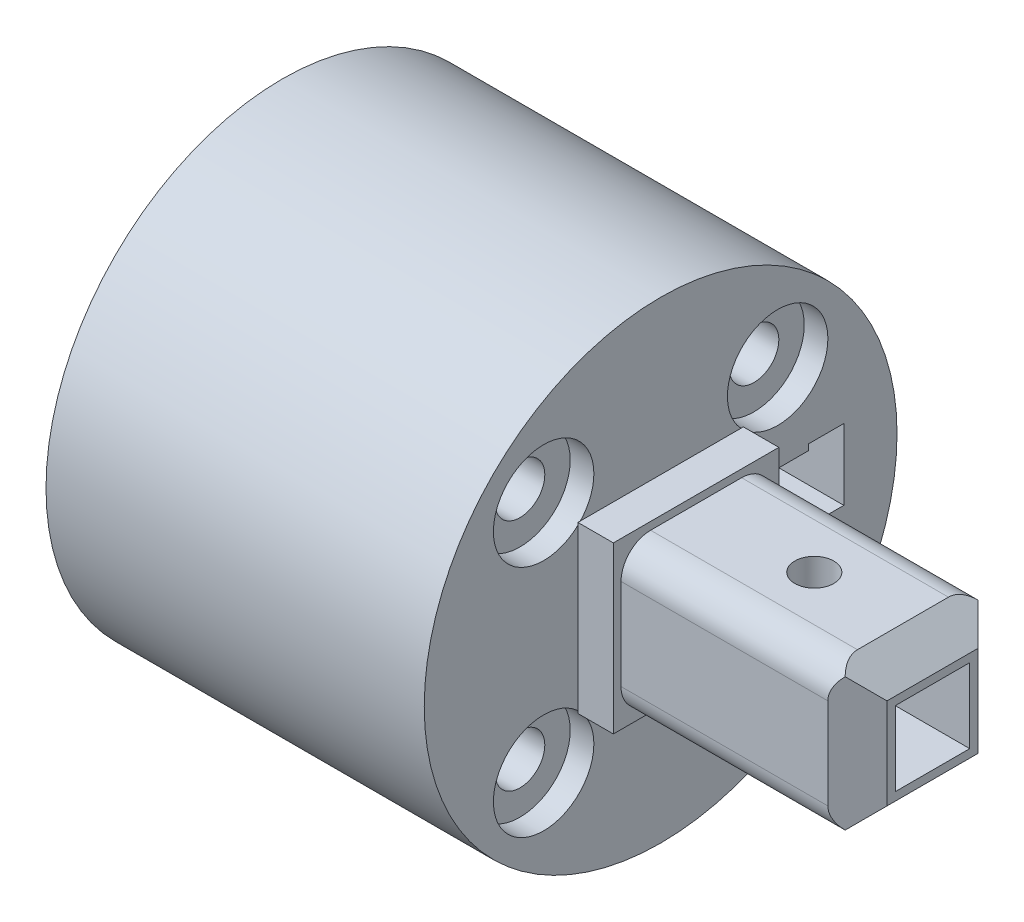
from build123d import *

# Parameters (mm, degrees)
SKETCH_1_R               = 20
EXTRUDE_1_DEPTH          = 5
SKETCH_2_W               = 6.3
SKETCH_2_H               = 6.3
CUT_EXTRUDE_1_DEPTH      = 5
EXTRUDE_START            = 7
SKETCH_4_R               = 20
SKETCH_4_R_2             = 10
EXTRUDE_2_DEPTH          = 7
CUT_EXTRUDE_2_DEPTH      = 20
CUT_EXTRUDE_2_DEPTH_BACK = 20
SKETCH_3_R               = 2.1
SKETCH_5_W               = 3
SKETCH_5_H               = 6
CUT_EXTRUDE_3_DEPTH      = 13
CHAMFER_1_SIZE           = 1
EXTRUDE_START_2          = 20
SKETCH_6_R               = 20
SKETCH_6_R_2             = 18
EXTRUDE_3_DEPTH          = 20
CHAMFER_2_SIZE           = 1
SKETCH_7_R               = 4.25
CUT_EXTRUDE_4_DEPTH      = 2
SKETCH_8_W               = 14
SKETCH_8_H               = 14
EXTRUDE_4_DEPTH          = 3
SKETCH_9_W               = 6.3
SKETCH_9_H               = 6.3
CUT_EXTRUDE_5_DEPTH      = 10
CUT_EXTRUDE_6_DEPTH      = 6
CUT_EXTRUDE_6_DEPTH_BACK = 5
SKETCH_10_W              = 3
SKETCH_10_H              = 5
FILLET_1_R               = 4
FILLET_2_R               = 2
SKETCH_11_W              = 12.7
SKETCH_11_H              = 12.7
SKETCH_11_W_2            = 6.3
SKETCH_11_H_2            = 6.3
EXTRUDE_5_DEPTH          = 20
CHAMFER_3_SIZE           = 2.5
SKETCH_12_R              = 1.65
CUT_EXTRUDE_7_DEPTH      = 20
FILLET_3_R               = 2.5


with BuildPart() as part:
    # 草图1 → 凸台-拉伸1 (new body)
    with BuildSketch(Plane(origin=(0, 0, 0), x_dir=(0, 0, -1), z_dir=(1, 0, 0))):
        Circle(SKETCH_1_R)
    extrude(amount=EXTRUDE_1_DEPTH)

    # 草图2 → 切除-拉伸1 (cut)
    with BuildSketch(Plane(origin=(5, 0, 0), x_dir=(0, 0, -1), z_dir=(1, 0, 0))):
        Rectangle(SKETCH_2_W, SKETCH_2_H)
    extrude(amount=-CUT_EXTRUDE_1_DEPTH, mode=Mode.SUBTRACT)

    # 草图4 → 凸台-拉伸2 (add)
    with BuildSketch(Plane.ZY.offset(EXTRUDE_START)):
        Circle(SKETCH_4_R)
        Circle(SKETCH_4_R_2, mode=Mode.SUBTRACT)
    extrude(amount=-EXTRUDE_2_DEPTH)

    # 草图3 → 切除-拉伸2 (cut, two sides: drawn at the far end of the back side and taken through both)
    with BuildSketch(Plane.ZY.offset(-CUT_EXTRUDE_2_DEPTH_BACK)):
        with Locations(Location((9.899494937, -9.899494937, 0), (0, 0, 180))):
            Circle(SKETCH_3_R)
        with Locations(Location((-9.899494937, -9.899494937, 0), (0, 0, 180))):
            Circle(SKETCH_3_R)
        with Locations(Location((-9.899494937, 9.899494937, 0), (0, 0, 180))):
            Circle(SKETCH_3_R)
        with Locations(Location((9.899494937, 9.899494937, 0), (0, 0, 180))):
            Circle(SKETCH_3_R)
    extrude(amount=CUT_EXTRUDE_2_DEPTH + CUT_EXTRUDE_2_DEPTH_BACK, mode=Mode.SUBTRACT)

    # 草图5 → 切除-拉伸3 (cut)
    with BuildSketch(Plane(origin=(5, 0, 0), x_dir=(0, 0, -1), z_dir=(1, 0, 0))):
        with Locations((14, 0)):
            Rectangle(SKETCH_5_W, SKETCH_5_H)
    extrude(amount=-CUT_EXTRUDE_3_DEPTH, mode=Mode.SUBTRACT)

    # 倒角1
    chamfer_1_edges = [part.edges().sort_by_distance(p)[0] for p in [
        (-7, -3, -14),
        (-7, 0, -15.5),
        (-7, 3, -14),
        (-7, 0, -12.5),
    ]]
    chamfer(chamfer_1_edges, length=CHAMFER_1_SIZE)

    # 草图6 → 凸台-拉伸3 (add)
    with BuildSketch(Plane.ZY.offset(7).offset(EXTRUDE_START_2)):
        Circle(SKETCH_6_R)
        Circle(SKETCH_6_R_2, mode=Mode.SUBTRACT)
    extrude(amount=-EXTRUDE_3_DEPTH)

    # 倒角2
    chamfer_2_edges = [part.edges().sort_by_distance(p)[0] for p in [
        (-27, 0, -18),
    ]]
    chamfer(chamfer_2_edges, length=CHAMFER_2_SIZE)

    # 草图7 → 切除-拉伸4 (cut)
    with BuildSketch(Plane(origin=(5, 0, 0), x_dir=(0, 0, -1), z_dir=(1, 0, 0))):
        with Locations((-9.899494937, 9.899494937)):
            Circle(SKETCH_7_R)
        with Locations((9.899494937, 9.899494937)):
            Circle(SKETCH_7_R)
        with Locations((9.899494937, -9.899494937)):
            Circle(SKETCH_7_R)
        with Locations((-9.899494937, -9.899494937)):
            Circle(SKETCH_7_R)
    extrude(amount=-CUT_EXTRUDE_4_DEPTH, mode=Mode.SUBTRACT)

    # 草图8 → 凸台-拉伸4 (add)
    with BuildSketch(Plane(origin=(5, 0, 0), x_dir=(0, 0, -1), z_dir=(1, 0, 0))):
        Rectangle(SKETCH_8_W, SKETCH_8_H)
    extrude(amount=EXTRUDE_4_DEPTH)

    # 草图9 → 切除-拉伸5 (cut)
    with BuildSketch(Plane.ZY.offset(-5)):
        Rectangle(SKETCH_9_W, SKETCH_9_H)
    extrude(amount=-CUT_EXTRUDE_5_DEPTH, mode=Mode.SUBTRACT)

    # 草图10 → 切除-拉伸6 (cut, two sides: drawn at the far end of the back side and taken through both)
    with BuildSketch(Plane(origin=(0, 0, -7), x_dir=(-1, 0, 0), z_dir=(0, 0, -1)).offset(-CUT_EXTRUDE_6_DEPTH_BACK)):
        with Locations((-5, 0)):
            Rectangle(SKETCH_10_W, SKETCH_10_H)
    extrude(amount=CUT_EXTRUDE_6_DEPTH + CUT_EXTRUDE_6_DEPTH_BACK, mode=Mode.SUBTRACT)

    # 圆角1
    fillet_1_edges = [part.edges().sort_by_distance(p)[0] for p in [
        (3.5, 0, -12.5),
    ]]
    fillet(fillet_1_edges, radius=FILLET_1_R)

    # 圆角2
    # the kernel refuses this fillet: 2 mm, written as the material it takes off along each edge
    with BuildSketch(Plane(origin=(6.5, 2.5, -3.15), x_dir=(1, 0, 0), z_dir=(0, -1, 0))) as fillet_2_piece_1:
        with BuildLine():
            CenterArc((FILLET_2_R, -FILLET_2_R), FILLET_2_R, 90, 90)
            Line((0, -FILLET_2_R), (0, 0))
            Line((0, 0), (FILLET_2_R, 0))
        make_face()
    extrude(amount=5, mode=Mode.SUBTRACT)

    # 草图11 → 凸台-拉伸5 (add)
    with BuildSketch(Plane(origin=(8, 0, 0), x_dir=(0, 0, -1), z_dir=(1, 0, 0))):
        Rectangle(SKETCH_11_W, SKETCH_11_H)
        Rectangle(SKETCH_11_W_2, SKETCH_11_H_2, mode=Mode.SUBTRACT)
    extrude(amount=EXTRUDE_5_DEPTH)

    # 倒角3
    chamfer_3_edges = [part.edges().sort_by_distance(p)[0] for p in [
        (28, 0, 6.35),
        (28, -6.35, 0),
        (28, 0, -6.35),
        (28, 6.35, 0),
    ]]
    chamfer(chamfer_3_edges, length=CHAMFER_3_SIZE)

    # 草图12 → 切除-拉伸7 (cut)
    with BuildSketch(Plane.XZ.offset(6.35)):
        with Locations(Location((18, 0, 0), (0, 0, 270))):
            Circle(SKETCH_12_R)
    extrude(amount=-CUT_EXTRUDE_7_DEPTH, mode=Mode.SUBTRACT)

    # 圆角3
    fillet_3_edges = [part.edges().sort_by_distance(p)[0] for p in [
        (16.75, 6.35, 6.35),
        (16.75, 6.35, -6.35),
        (16.75, -6.35, -6.35),
        (16.75, -6.35, 6.35),
    ]]
    fillet(fillet_3_edges, radius=FILLET_3_R)


solid = part.part
